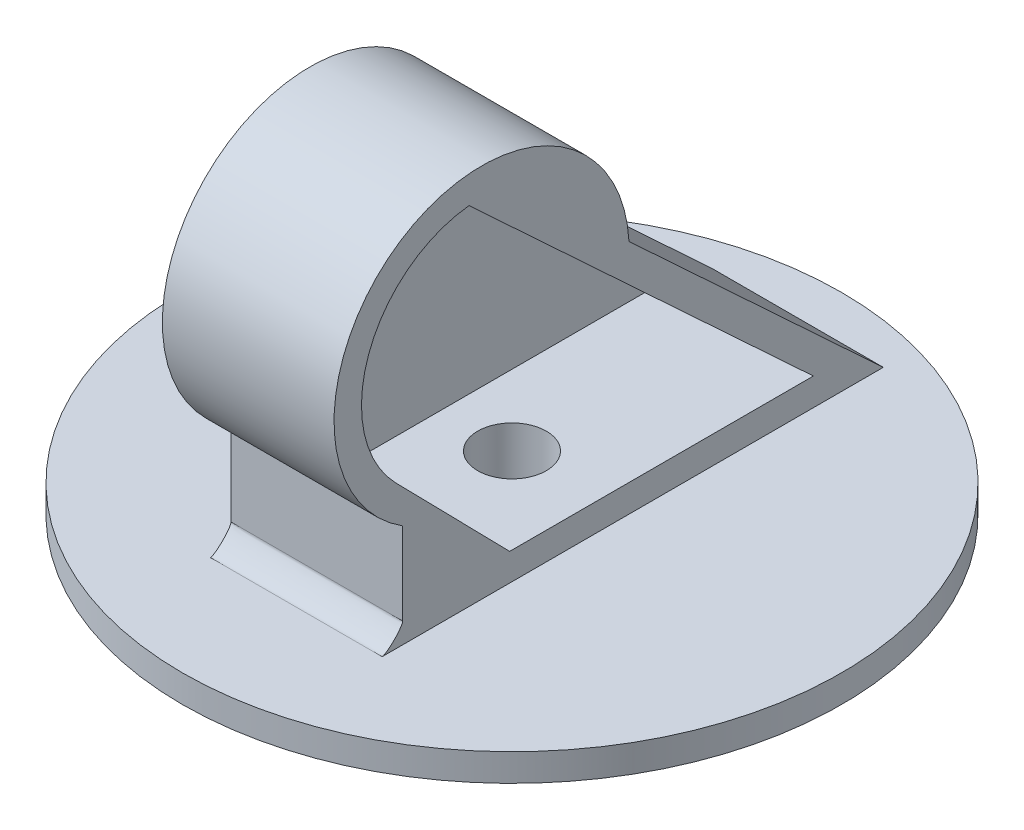
from build123d import *

# Parameters (mm, degrees)
CROQUIS3_R              = 48
SALIENTE_EXTRUIR2_DEPTH = 4
CROQUIS5_R              = 1.75
CORTAR_EXTRUIR3_DEPTH   = 1.1
REDONDEO3_R             = 1.1
MATRIZC5_COUNT          = 8
REDONDEO3_OF_MATRIZC5_R = 1.1
SALIENTE_EXTRUIR3_DEPTH = 12.5
REDONDEO4_START         = -12.5
REDONDEO4_DEPTH         = 25
CORTAR_EXTRUIR4_DEPTH   = 22.8
CROQUIS8_R              = 5
CORTAR_EXTRUIR5_DEPTH   = 14.8


with BuildPart() as part:
    # Croquis3 → Saliente-Extruir2 (new body)
    with BuildSketch(Plane(origin=(0, 0, 0), x_dir=(1, 0, 0), z_dir=(0, 1, 0))):
        with Locations(Location((0, 140.82362169, 0), (0, 0, 270))):
            Circle(CROQUIS3_R)
    extrude(amount=SALIENTE_EXTRUIR2_DEPTH)

    # Croquis5 → Cortar-Extruir3 (cut)
    with BuildSketch(Plane.XZ):
        with Locations(Location((0, -99.57362169, 0), (0, 0, 270))):
            Circle(CROQUIS5_R)
    cortar_extruir3 = extrude(amount=-CORTAR_EXTRUIR3_DEPTH, mode=Mode.SUBTRACT)

    # Redondeo3
    redondeo3_edges = [part.edges().sort_by_distance(p)[0] for p in [
        (0, 1.1, -97.82362169),
    ]]
    fillet(redondeo3_edges, radius=REDONDEO3_R - 0.0001)  # a hair under: the kernel refuses the full size

    # MatrizC5: Cortar-Extruir3 ×8 about axis
    matrizc5_axis = Axis((0, 0, -140.82362169), (0, 1, 0))
    for i in range(1, MATRIZC5_COUNT):
        add(cortar_extruir3.rotate(matrizc5_axis, i * 360 / MATRIZC5_COUNT), mode=Mode.SUBTRACT)

    # Redondeo3 of MatrizC5
    redondeo3_of_matrizc5_edges = [part.edges().sort_by_distance(p)[0] for p in [
        (30.405591591, 1.1, -110.418030099),
        (43, 1.1, -140.82362169),
        (30.405591591, 1.1, -171.229213281),
        (0, 1.1, -183.82362169),
        (-30.405591591, 1.1, -171.229213281),
        (-43, 1.1, -140.82362169),
        (-30.405591591, 1.1, -110.418030099),
    ]]
    fillet(redondeo3_of_matrizc5_edges, radius=REDONDEO3_OF_MATRIZC5_R - 0.0001)  # a hair under: the kernel refuses the full size

    # Croquis6 → Saliente-Extruir3 (add, symmetric)
    with BuildSketch(Plane(origin=(0, 0, 0), x_dir=(0, 0, -1), z_dir=(1, 0, 0))):
        with BuildLine():
            ThreePointArc((145.401441519, 37.169010455), (145.39274788, 37.78036216), (145.366673993, 38.391219459))
            Line((145.366673993, 38.391219459), (112.406353043, 19))
            ThreePointArc((112.406353043, 19), (134.272208071, 18.335603936), (145.401441519, 37.169010455))
        make_face()
        with BuildLine():
            Line((112.406353043, 19), (145.366673993, 38.391219459))
            ThreePointArc((145.366673993, 38.391219459), (112.999341224, 55.699909223), (112.406353043, 19))
        make_face()
        with BuildLine():
            Line((112.406353043, 4), (182.406353043, 4))
            Line((182.406353043, 4), (145.366673993, 38.391219459))
            ThreePointArc((145.366673993, 38.391219459), (145.39274788, 37.78036216), (145.401441519, 37.169010455))
            ThreePointArc((145.401441519, 37.169010455), (134.272208071, 18.335603936), (112.406353043, 19))
            Line((112.406353043, 19), (112.406353043, 4))
        make_face()
    extrude(amount=SALIENTE_EXTRUIR3_DEPTH, both=True)

    # Redondeo4: read off the stored shape, not the designer's step
    # Redondeo4 outline → Redondeo4 (add)
    with BuildSketch(Plane.YZ.offset(REDONDEO4_START)):
        with BuildLine():
            add(Edge.make_bspline(
                [(4, -109.406353043), (4, -112.406353043), (7, -112.406353043)],
                knots=[0, 0, 0, 1, 1, 1], degree=2, weights=[1, 0.212132034, 1]))
            Line((4, -109.406353043), (4, -112.406353043))
            Line((4, -112.406353043), (7, -112.406353043))
        make_face()
    extrude(amount=REDONDEO4_DEPTH)

    # Croquis7 → Cortar-Extruir4 (cut)
    with BuildSketch(Plane(origin=(12.5, 0, 0), x_dir=(0, 0, -1), z_dir=(1, 0, 0))):
        with BuildLine():
            Line((111.403468482, 24.919493324), (141.392905589, 36.622489926))
            Line((141.392905589, 36.622489926), (122.06113227, 54.571977497))
            ThreePointArc((122.06113227, 54.571977497), (107.432864193, 43.088128705), (111.403468482, 24.919493324))
        make_face()
        with BuildLine():
            ThreePointArc((111.403468482, 24.919493324), (130.263341435, 20.866365594), (141.392905589, 36.622489926))
            Line((141.392905589, 36.622489926), (111.403468482, 24.919493324))
        make_face()
        with BuildLine():
            Line((172.219606624, 8), (141.392905589, 36.622489926))
            ThreePointArc((141.392905589, 36.622489926), (130.263341435, 20.866365594), (111.403468482, 24.919493324))
            Line((111.403468482, 24.919493324), (127.986607419, 8))
            Line((127.986607419, 8), (172.219606624, 8))
        make_face()
    extrude(amount=-CORTAR_EXTRUIR4_DEPTH, mode=Mode.SUBTRACT)

    # Croquis8 → Cortar-Extruir5 (cut)
    with BuildSketch(Plane(origin=(0, 0, 0), x_dir=(1, 0, 0), z_dir=(0, 1, 0))):
        with Locations(Location((0, 140.82362169, 0), (0, 0, 90))):
            Circle(CROQUIS8_R)
    extrude(amount=CORTAR_EXTRUIR5_DEPTH, mode=Mode.SUBTRACT)


solid = part.part
